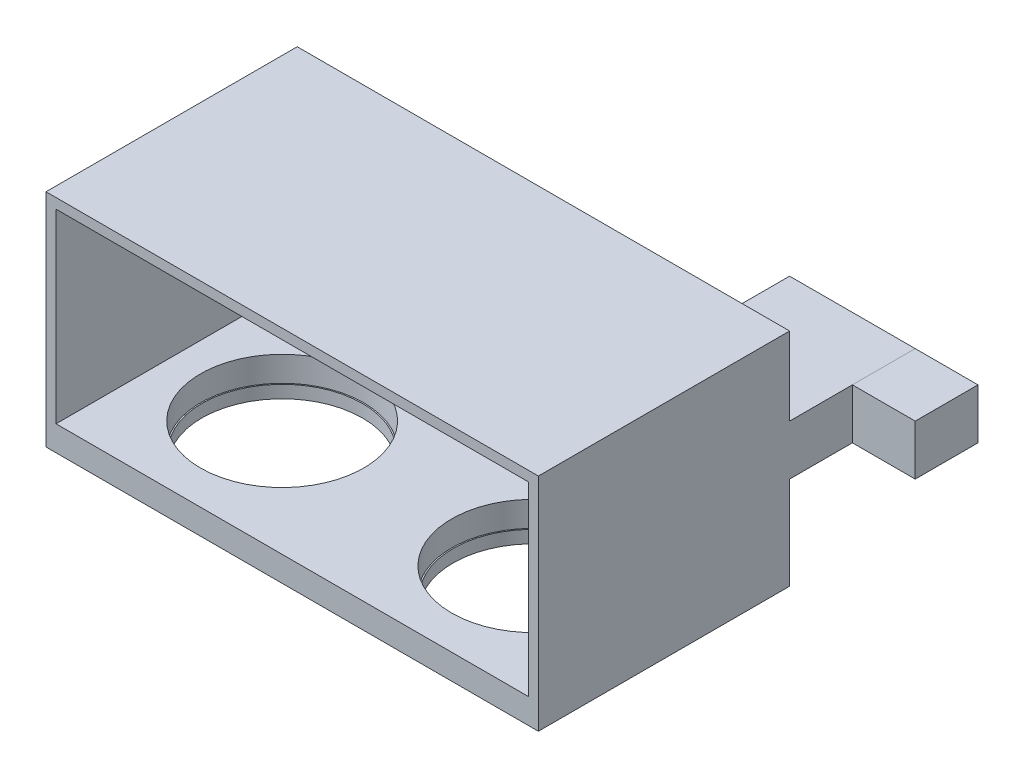
from build123d import *

# Parameters (mm, degrees)
SKETCH1_W           = 49.784
SKETCH1_H           = 23.876
BOSS_EXTRUDE1_DEPTH = 25.4
SHELL1_T            = -2.54
CUT_EXTRUDE1_REACH  = 44.835
SKETCH2_R           = 8.255
CUT_EXTRUDE2_REACH  = 37.843
SKETCH4_W           = 11.684
SKETCH4_H           = 17.78
SKETCH5_R           = 10.541
SKETCH5_R_2         = 8.128
BOSS_EXTRUDE3_DEPTH = 1.27
BOSS_EXTRUDE4_DEPTH = 12.7
SKETCH8_W           = 6.35
SKETCH8_H           = 5.08
BOSS_EXTRUDE5_DEPTH = 6.35
SKETCH9_W           = 22.86
SKETCH9_H           = 18.796
CUT_EXTRUDE3_DEPTH  = 1.524
SKETCH10_W          = 22.86
SKETCH10_H          = 18.796
CUT_EXTRUDE4_DEPTH  = 1.524
CHAMFER1_SIZE       = 1.27
SKETCH11_W          = 49.784
SKETCH11_H          = 25.4
CUT_EXTRUDE5_DEPTH  = 1.524


with BuildPart() as part:
    # Sketch1 → Boss-Extrude1 (new body)
    with BuildSketch(Plane.XY):
        Rectangle(SKETCH1_W, SKETCH1_H)
    extrude(amount=-BOSS_EXTRUDE1_DEPTH)

    # Shell1
    shell1_openings = [part.faces().sort_by_distance(p)[0] for p in [
        (0, 0, 0),
    ]]
    offset(amount=SHELL1_T, openings=shell1_openings, kind=Kind.INTERSECTION)

    # Sketch2 → Cut-Extrude1 (cut, up to next)
    with BuildSketch(Plane.XZ.offset(11.938), mode=Mode.PRIVATE) as cut_extrude1_sk1:
        with Locations(Location((-12.7, -11.684, 0), (0, 0, 270))):
            Circle(SKETCH2_R)
    cut_extrude1_tool1 = extrude(cut_extrude1_sk1.sketch, amount=-CUT_EXTRUDE1_REACH, mode=Mode.PRIVATE) & part.part
    # Sketch2 → Cut-Extrude1 (cut, up to next)
    with BuildSketch(Plane.XZ.offset(11.938), mode=Mode.PRIVATE) as cut_extrude1_sk2:
        with Locations(Location((12.7, -11.684, 0), (0, 0, 270))):
            Circle(SKETCH2_R)
    cut_extrude1_tool2 = extrude(cut_extrude1_sk2.sketch, amount=-CUT_EXTRUDE1_REACH, mode=Mode.PRIVATE) & part.part
    add(cut_extrude1_tool1.solids().sort_by_distance((-12.7, -11.938, -11.684))[0], mode=Mode.SUBTRACT)
    add(cut_extrude1_tool2.solids().sort_by_distance((12.7, -11.938, -11.684))[0], mode=Mode.SUBTRACT)

    # Sketch4 → Cut-Extrude2 (cut, up to next)
    with BuildSketch(Plane.XY.offset(-22.86), mode=Mode.PRIVATE) as cut_extrude2_sk1:
        with Locations((0, 0.508)):
            Rectangle(SKETCH4_W, SKETCH4_H)
    cut_extrude2_tool1 = extrude(cut_extrude2_sk1.sketch, amount=-CUT_EXTRUDE2_REACH, mode=Mode.PRIVATE) & part.part
    add(cut_extrude2_tool1.solids().sort_by_distance((0, 0.508, -22.86))[0], mode=Mode.SUBTRACT)

    # Sketch5 → Boss-Extrude3 (add)
    # profile 1 of 2: a face of its own
    with BuildSketch(Plane.XZ.offset(11.938)):
        with Locations(Location((-12.7, -11.684, 0), (0, 0, 270))):
            Circle(SKETCH5_R)
        with Locations(Location((-12.7, -11.684, 0), (0, 0, 270))):
            Circle(SKETCH5_R_2, mode=Mode.SUBTRACT)
    # profile 2 of 2: a face of its own
    with BuildSketch(Plane.XZ.offset(11.938)):
        with Locations(Location((12.7, -11.684, 0), (0, 0, 270))):
            Circle(SKETCH5_R)
        with Locations(Location((12.7, -11.684, 0), (0, 0, 270))):
            Circle(SKETCH5_R_2, mode=Mode.SUBTRACT)
    extrude(amount=BOSS_EXTRUDE3_DEPTH)

    # Sketch7 → Boss-Extrude4 (add)
    with BuildSketch(Plane(origin=(0, 0, -25.4), x_dir=(-1, 0, 0), z_dir=(0, 0, -1))):
        Polygon((-24.892, 2.522876328), (-24.892, -2.557123672), (-12.192, -2.557123672), (-12.192, 2.516226298), align=None)
    extrude(amount=BOSS_EXTRUDE4_DEPTH)

    # Sketch8 → Boss-Extrude5 (add)
    with BuildSketch(Plane(origin=(24.892, 0, 0), x_dir=(0, 0, -1), z_dir=(1, 0, 0))):
        with Locations((34.925, -0.017123672)):
            Rectangle(SKETCH8_W, SKETCH8_H)
    extrude(amount=BOSS_EXTRUDE5_DEPTH)

    # Sketch9 → Cut-Extrude3 (cut)
    with BuildSketch(Plane(origin=(-22.352, 0, 0), x_dir=(0, 0, -1), z_dir=(1, 0, 0))):
        with Locations((11.43, 0)):
            Rectangle(SKETCH9_W, SKETCH9_H)
    extrude(amount=-CUT_EXTRUDE3_DEPTH, mode=Mode.SUBTRACT)

    # Sketch10 → Cut-Extrude4 (cut)
    with BuildSketch(Plane.ZY.offset(-22.352)):
        with Locations((-11.43, 0)):
            Rectangle(SKETCH10_W, SKETCH10_H)
    extrude(amount=-CUT_EXTRUDE4_DEPTH, mode=Mode.SUBTRACT)

    # Chamfer1
    chamfer1_edges = [part.edges().sort_by_distance(p)[0] for p in [
        (-12.7, -13.208, -1.143),
        (12.7, -13.208, -1.143),
    ]]
    chamfer(chamfer1_edges, length=CHAMFER1_SIZE - 0.0001)  # a hair under: the kernel refuses the full size

    # Sketch11 → Cut-Extrude5 (cut)
    with BuildSketch(Plane(origin=(0, 11.938, 0), x_dir=(1, 0, 0), z_dir=(0, 1, 0))):
        with Locations((0, 12.7)):
            Rectangle(SKETCH11_W, SKETCH11_H)
    extrude(amount=-CUT_EXTRUDE5_DEPTH, mode=Mode.SUBTRACT)


solid = part.part
